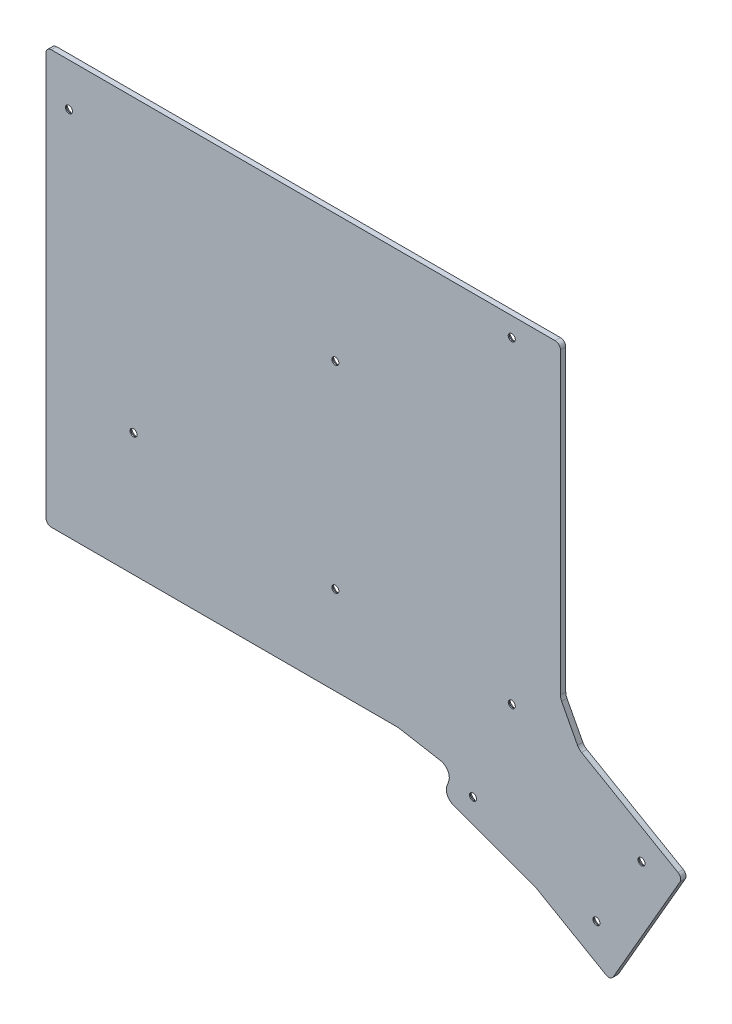
from build123d import *

# Parameters (mm, degrees)
BOSS_EXTRUDE1_DEPTH = 1.5
SKETCH6_R           = 1
CUT_EXTRUDE1_DEPTH  = 10
FILLET4_R           = 1.5
FILLET5_R           = 3


# Read off the part's stored shape, not the designer's step: AdvancedHole1
with BuildPart() as part:
    # Sketch1 → Boss-Extrude1 (new body)
    with BuildSketch(Plane.XY):
        Polygon((-133.021138037, 63.390093572), (12.778856844, 63.390093572), (12.778856844, -23.568490874), (18.017758559, -33.522553443), (47.405744057, -50.489714781), (27.001354783, -85.831153701), (5.566925134, -73.455979973), (-20.396575573, -64.006038538), (-17.68284447, -56.550123611), (-33.223388364, -53.809906428), (-133.021138037, -53.809906428), align=None)
    extrude(amount=BOSS_EXTRUDE1_DEPTH)

    # Sketch6 → Cut-Extrude1 (cut)
    with BuildSketch(Plane(origin=(0, 0, 0), x_dir=(-1, 0, 0), z_dir=(0, 0, -1))):
        with Locations((126.521138037, 51.256145572)):
            Circle(SKETCH6_R)
        with Locations((108.221138037, -18.975958428)):
            Circle(SKETCH6_R)
        with Locations((51.021138037, -28.759906428)):
            Circle(SKETCH6_R)
        with Locations((51.021138037, 27.224041572)):
            Circle(SKETCH6_R)
        with Locations((1.021138037, 57.990093572)):
            Circle(SKETCH6_R)
        with Locations((1.021138037, -32.009906428)):
            Circle(SKETCH6_R)
        with Locations((12.005086037, -60.259906428)):
            Circle(SKETCH6_R)
        with Locations((-35.744913963, -52.259906428)):
            Circle(SKETCH6_R)
        with Locations((-22.978861963, -73.259906428)):
            Circle(SKETCH6_R)
    extrude(amount=-CUT_EXTRUDE1_DEPTH, mode=Mode.SUBTRACT)

    # AdvancedHole1 outline → AdvancedHole1 (revolve, cut)
    with BuildSketch(Plane(origin=(35.744913963, -52.259906428, 0), x_dir=(1, 0, 0), z_dir=(0, -1, 0))):
        Polygon((2.2, 0), (1, 1.2), (1, 0), align=None)
    revolve(axis=Axis((35.744913963, -52.259906428, 0), (0, 0, 1)), mode=Mode.SUBTRACT)

    # AdvancedHole1 2 outline → AdvancedHole1 2 (revolve, cut)
    with BuildSketch(Plane(origin=(22.978861963, -73.259906428, 0), x_dir=(1, 0, 0), z_dir=(0, -1, 0))):
        Polygon((2.2, 0), (1, 1.2), (1, 0), align=None)
    revolve(axis=Axis((22.978861963, -73.259906428, 0), (0, 0, 1)), mode=Mode.SUBTRACT)

    # AdvancedHole1 3 outline → AdvancedHole1 3 (revolve, cut)
    with BuildSketch(Plane(origin=(-12.005086037, -60.259906428, 0), x_dir=(1, 0, 0), z_dir=(0, -1, 0))):
        Polygon((2.2, 0), (1, 1.2), (1, 0), align=None)
    revolve(axis=Axis((-12.005086037, -60.259906428, 0), (0, 0, 1)), mode=Mode.SUBTRACT)

    # AdvancedHole1 4 outline → AdvancedHole1 4 (revolve, cut)
    with BuildSketch(Plane(origin=(-1.021138037, -32.009906428, 0), x_dir=(1, 0, 0), z_dir=(0, -1, 0))):
        Polygon((2.2, 0), (1, 1.2), (1, 0), align=None)
    revolve(axis=Axis((-1.021138037, -32.009906428, 0), (0, 0, 1)), mode=Mode.SUBTRACT)

    # AdvancedHole1 5 outline → AdvancedHole1 5 (revolve, cut)
    with BuildSketch(Plane(origin=(-51.021138037, -28.759906428, 0), x_dir=(1, 0, 0), z_dir=(0, -1, 0))):
        Polygon((2.2, 0), (1, 1.2), (1, 0), align=None)
    revolve(axis=Axis((-51.021138037, -28.759906428, 0), (0, 0, 1)), mode=Mode.SUBTRACT)

    # AdvancedHole1 6 outline → AdvancedHole1 6 (revolve, cut)
    with BuildSketch(Plane(origin=(-108.221138037, -18.975958428, 0), x_dir=(1, 0, 0), z_dir=(0, -1, 0))):
        Polygon((2.2, 0), (1, 1.2), (1, 0), align=None)
    revolve(axis=Axis((-108.221138037, -18.975958428, 0), (0, 0, 1)), mode=Mode.SUBTRACT)

    # AdvancedHole1 7 outline → AdvancedHole1 7 (revolve, cut)
    with BuildSketch(Plane(origin=(-126.521138037, 51.256145572, 0), x_dir=(1, 0, 0), z_dir=(0, -1, 0))):
        Polygon((2.2, 0), (1, 1.2), (1, 0), align=None)
    revolve(axis=Axis((-126.521138037, 51.256145572, 0), (0, 0, 1)), mode=Mode.SUBTRACT)

    # AdvancedHole1 8 outline → AdvancedHole1 8 (revolve, cut)
    with BuildSketch(Plane(origin=(-51.021138037, 27.224041572, 0), x_dir=(1, 0, 0), z_dir=(0, -1, 0))):
        Polygon((2.2, 0), (1, 1.2), (1, 0), align=None)
    revolve(axis=Axis((-51.021138037, 27.224041572, 0), (0, 0, 1)), mode=Mode.SUBTRACT)

    # AdvancedHole1 9 outline → AdvancedHole1 9 (revolve, cut)
    with BuildSketch(Plane(origin=(-1.021138037, 57.990093572, 0), x_dir=(1, 0, 0), z_dir=(0, -1, 0))):
        Polygon((2.2, 0), (1, 1.2), (1, 0), align=None)
    revolve(axis=Axis((-1.021138037, 57.990093572, 0), (0, 0, 1)), mode=Mode.SUBTRACT)

    # Fillet4
    fillet4_edges = [part.edges().sort_by_distance(p)[0] for p in [
        (-133.021138037, 63.390093572, 0.75),
        (12.778856844, 63.390093572, 0.75),
        (47.405744057, -50.489714781, 0.75),
        (27.001354783, -85.831153701, 0.75),
        (-133.021138037, -53.809906428, 0.75),
    ]]
    fillet(fillet4_edges, radius=FILLET4_R)

    # Fillet5
    fillet5_edges = [part.edges().sort_by_distance(p)[0] for p in [
        (12.778856844, -23.568490874, 0.75),
        (18.017758559, -33.522553443, 0.75),
        (-20.396575573, -64.006038538, 0.75),
        (-17.68284447, -56.550123611, 0.75),
        (-33.223388364, -53.809906428, 0.75),
    ]]
    fillet(fillet5_edges, radius=FILLET5_R)


solid = part.part
